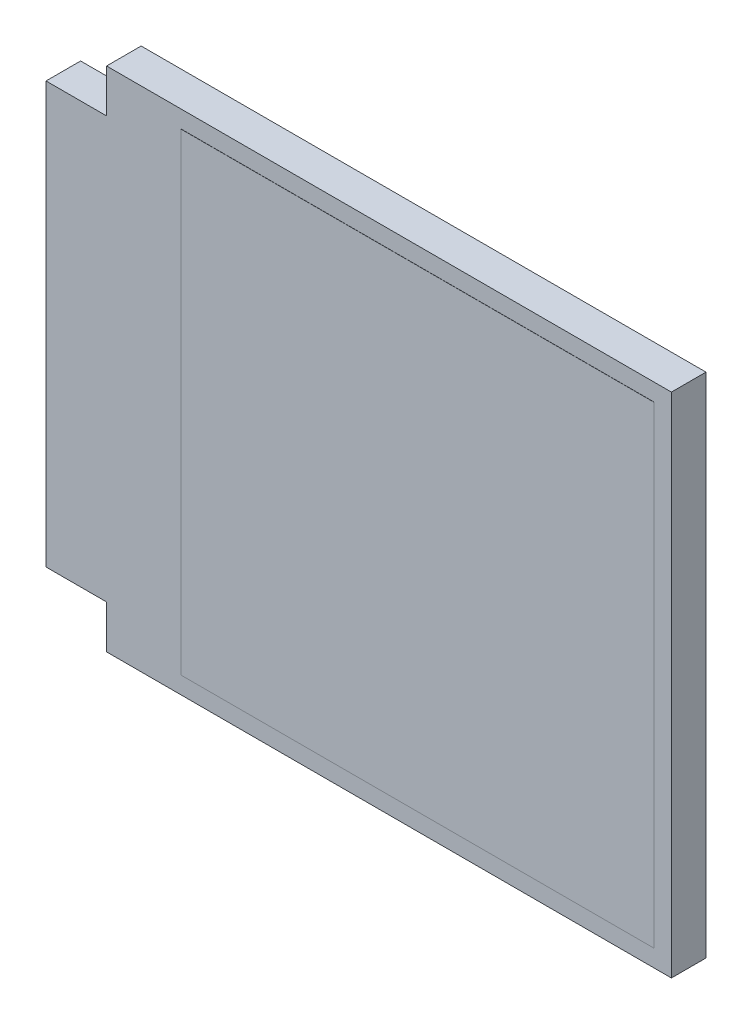
from build123d import *

# Parameters (mm, degrees)
BOSS_EXTRU_1_DEPTH = 2
ESQUISSE2_W        = 27.34
ESQUISSE2_H        = 27.34
BOSS_EXTRU_2_DEPTH = 0.01


with BuildPart() as part:
    # Esquisse1 → Boss.-Extru.1 (new body)
    with BuildSketch(Plane.XY):
        Polygon((-51.551560295, 5.41), (-48.051560295, 5.41), (-48.051560295, 2.91), (-15.391560295, 2.91), (-15.391560295, 32.25), (-48.051560295, 32.25), (-48.051560295, 29.75), (-51.551560295, 29.75), align=None)
    extrude(amount=BOSS_EXTRU_1_DEPTH)

    # Esquisse2 → Boss.-Extru.2 (add)
    with BuildSketch(Plane.XY.offset(2)):
        with Locations((-30.061560295, 17.58)):
            Rectangle(ESQUISSE2_W, ESQUISSE2_H)
    extrude(amount=BOSS_EXTRU_2_DEPTH)


solid = part.part
